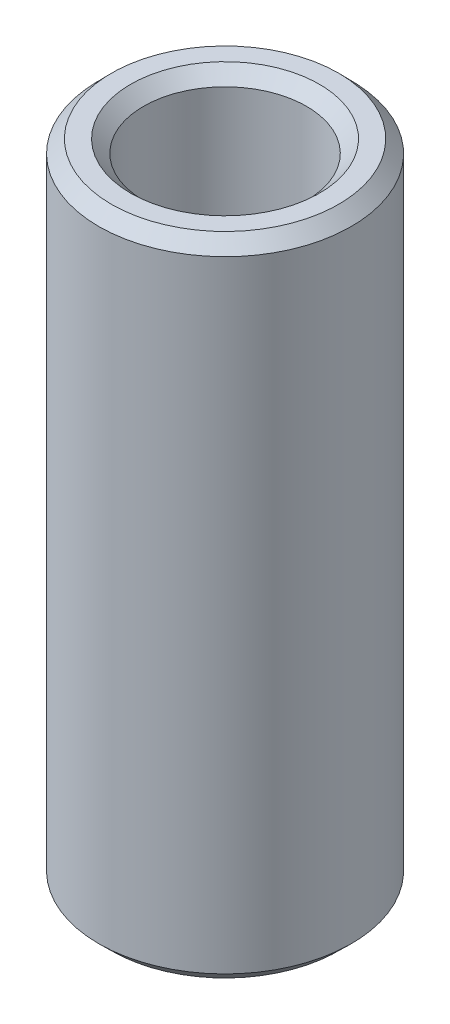
from build123d import *
from OCP.BRepFilletAPI import BRepFilletAPI_MakeChamfer

# Parameters (mm, degrees)
SKETCH1_R           = 7.5
BOSS_EXTRUDE1_DEPTH = 38.415699261
SKETCH2_R           = 4.842400678
CUT_EXTRUDE1_DEPTH  = 40.853054459
CHAMFER1_SIZE       = 0.765947849
CHAMFER1_SIZE2      = 0.750762738


with BuildPart() as part:
    # Sketch1 → Boss-Extrude1 (new body)
    with BuildSketch(Plane(origin=(0, 0, 0), x_dir=(1, 0, 0), z_dir=(0, 1, 0))):
        Circle(SKETCH1_R)
    extrude(amount=BOSS_EXTRUDE1_DEPTH)

    # Sketch2 → Cut-Extrude1 (cut, through all)
    with BuildSketch(Plane(origin=(0, 0, 0), x_dir=(1, 0, 0), z_dir=(0, 1, 0))):
        Circle(SKETCH2_R)
    extrude(amount=CUT_EXTRUDE1_DEPTH, mode=Mode.SUBTRACT)

    # Chamfer1: one chamfer whose edges measure the first distance from different faces: ONE call of the kernel's chamfer builder (chamfer() names one face for all edges)
    chamfer1_edges_1 = [part.edges().sort_by_distance(p)[0] for p in [
        (-4.842400678, 38.415699261, 0),
    ]]
    chamfer1_side_1 = [part.faces().sort_by_distance(p)[0] for p in [
        (-7.287867966, 38.415699261, 0),
    ]]
    chamfer1_edges_2 = [part.edges().sort_by_distance(p)[0] for p in [
        (-4.842400678, 0, 0),
    ]]
    chamfer1_side_2 = [part.faces().sort_by_distance(p)[0] for p in [
        (-4.842400678, 19.20784963, 0),
    ]]
    chamfer1_edges_3 = [part.edges().sort_by_distance(p)[0] for p in [
        (-7.5, 0, 0),
    ]]
    chamfer1_side_3 = [part.faces().sort_by_distance(p)[0] for p in [
        (-7.287867966, 0, 0),
    ]]
    chamfer1_edges_4 = [part.edges().sort_by_distance(p)[0] for p in [
        (-7.5, 38.415699261, 0),
    ]]
    chamfer1_side_4 = [part.faces().sort_by_distance(p)[0] for p in [
        (-7.5, 19.20784963, 0),
    ]]
    chamfer1 = BRepFilletAPI_MakeChamfer(part.part.solid().wrapped)
    for e in chamfer1_edges_1:
        chamfer1.Add(CHAMFER1_SIZE, CHAMFER1_SIZE2, e.wrapped, chamfer1_side_1[0].wrapped)  # the first distance lies on this face
    for e in chamfer1_edges_2:
        chamfer1.Add(CHAMFER1_SIZE, CHAMFER1_SIZE2, e.wrapped, chamfer1_side_2[0].wrapped)  # the first distance lies on this face
    for e in chamfer1_edges_3:
        chamfer1.Add(CHAMFER1_SIZE, CHAMFER1_SIZE2, e.wrapped, chamfer1_side_3[0].wrapped)  # the first distance lies on this face
    for e in chamfer1_edges_4:
        chamfer1.Add(CHAMFER1_SIZE, CHAMFER1_SIZE2, e.wrapped, chamfer1_side_4[0].wrapped)  # the first distance lies on this face
    add(Compound.cast(chamfer1.Shape()), mode=Mode.REPLACE)


solid = part.part
